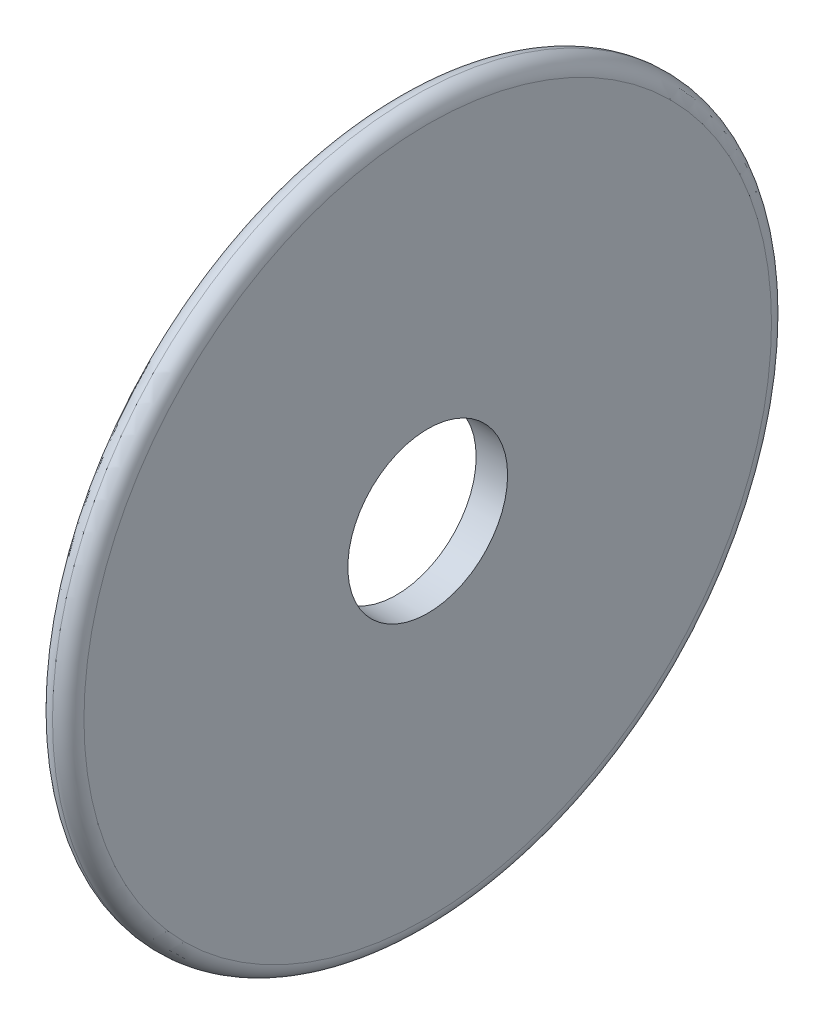
from build123d import *

# Parameters (mm, degrees)
SKETCH1_R           = 57.15
BOSS_EXTRUDE1_DEPTH = 5
SKETCH2_R           = 12.7
CUT_EXTRUDE1_DEPTH  = 81.97681767
FILLET1_R           = 2.5


with BuildPart() as part:
    # Sketch1 → Boss-Extrude1 (new body)
    with BuildSketch(Plane(origin=(0, 0, 0), x_dir=(0, 0, -1), z_dir=(1, 0, 0))):
        Circle(SKETCH1_R)
    extrude(amount=BOSS_EXTRUDE1_DEPTH)

    # Sketch2 → Cut-Extrude1 (cut, through all)
    with BuildSketch(Plane(origin=(5, 0, 0), x_dir=(0, 0, -1), z_dir=(1, 0, 0))):
        Circle(SKETCH2_R)
    extrude(amount=-CUT_EXTRUDE1_DEPTH, mode=Mode.SUBTRACT)

    # Fillet1
    fillet1_edges = [part.edges().sort_by_distance(p)[0] for p in [
        (0, 0, 57.15),
        (5, 0, 57.15),
    ]]
    fillet(fillet1_edges, radius=FILLET1_R - 0.0001)  # a hair under: the kernel refuses the full size


solid = part.part
